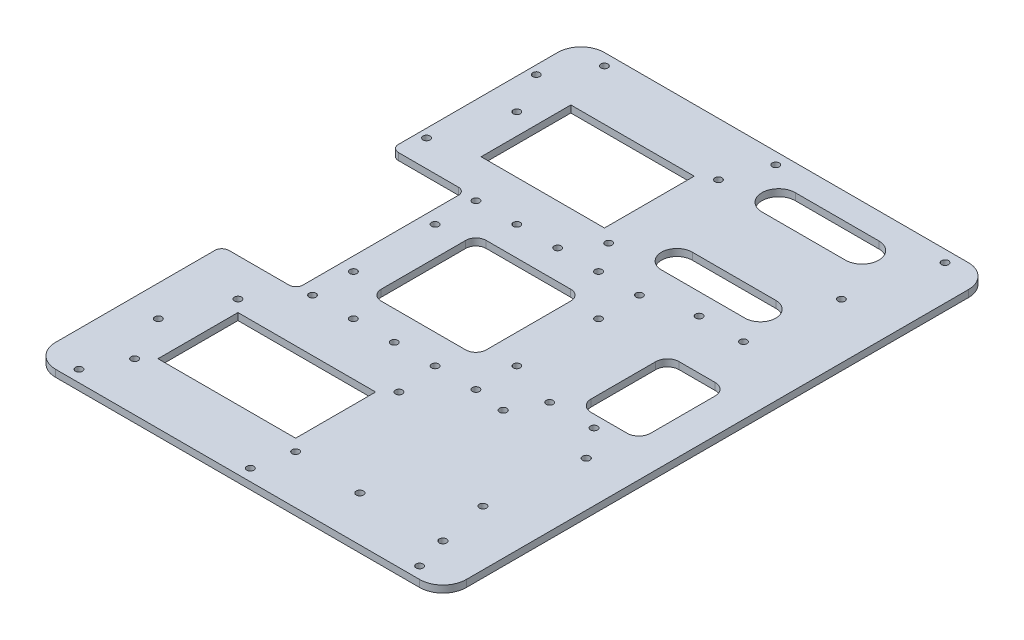
from build123d import *

# Parameters (mm, degrees)
SKETCH_2_R          = 1.5
SKETCH_2_R_2        = 1.55
SKETCH_2_W          = 58.95
SKETCH_2_H          = 34.26
SKETCH_2_W_2        = 25.458045559
SKETCH_2_H_2        = 37.682827862
SKETCH_2_W_3        = 52.836453453
SKETCH_2_H_3        = 38.433812924
EXTRUDE_2_DEPTH     = 3
FILLET_2_R          = 3
FILLET_3_R          = 5
CUT_EXTRUDE_1_DEPTH = 157.537629335
SKETCH_4_R          = 1.5
CUT_EXTRUDE_2_DEPTH = 10


with BuildPart() as part:
    # 草图2 → 凸台-拉伸2 (new body)
    with BuildSketch(Plane(origin=(0, 0, 0), x_dir=(1, 0, 0), z_dir=(0, 1, 0))):
        with BuildLine():
            Line((-72.5, -36.293945631), (-72.5, -107.5))
            ThreePointArc((-72.5, -107.5), (-69.571067812, -114.571067812), (-62.5, -117.5))
            Line((-62.5, -117.5), (93.386553273, -117.5))
            ThreePointArc((93.386553273, -117.5), (100.457621085, -114.571067812), (103.386553273, -107.5))
            Line((103.386553273, -107.5), (103.386553273, 107.5))
            ThreePointArc((103.386553273, 107.5), (100.457621085, 114.571067812), (93.386553273, 117.5))
            Line((93.386553273, 117.5), (-62.5, 117.5))
            ThreePointArc((-62.5, 117.5), (-69.571067812, 114.571067812), (-72.5, 107.5))
            Line((-72.5, 107.5), (-72.5, 36.293945631))
            Line((-72.5, 36.293945631), (-40.778460838, 36.293945631))
            Line((-40.778460838, 36.293945631), (-40.778460838, -36.293945631))
            Line((-40.778460838, -36.293945631), (-72.5, -36.293945631))
        make_face()
        with Locations((-35, 35)):
            Circle(SKETCH_2_R, mode=Mode.SUBTRACT)
        with Locations((35, 35)):
            Circle(SKETCH_2_R, mode=Mode.SUBTRACT)
        with Locations((35, -35)):
            Circle(SKETCH_2_R, mode=Mode.SUBTRACT)
        with Locations((-35, -35)):
            Circle(SKETCH_2_R, mode=Mode.SUBTRACT)
        with Locations((-17.5, 35)):
            Circle(SKETCH_2_R, mode=Mode.SUBTRACT)
        with Locations((17.5, 35)):
            Circle(SKETCH_2_R, mode=Mode.SUBTRACT)
        with Locations((-17.5, -35)):
            Circle(SKETCH_2_R, mode=Mode.SUBTRACT)
        with Locations((17.5, -35)):
            Circle(SKETCH_2_R, mode=Mode.SUBTRACT)
        with Locations((-35, 17.5)):
            Circle(SKETCH_2_R, mode=Mode.SUBTRACT)
        with Locations((-35, -17.5)):
            Circle(SKETCH_2_R, mode=Mode.SUBTRACT)
        with Locations((35, -17.5)):
            Circle(SKETCH_2_R, mode=Mode.SUBTRACT)
        with Locations((35, 17.5)):
            Circle(SKETCH_2_R, mode=Mode.SUBTRACT)
        with Locations((0, 35)):
            Circle(SKETCH_2_R, mode=Mode.SUBTRACT)
        with Locations((0, -35)):
            Circle(SKETCH_2_R, mode=Mode.SUBTRACT)
        with Locations((-49.509707517, -52.404109444)):
            Circle(SKETCH_2_R, mode=Mode.SUBTRACT)
        with Locations((-49.509707517, -96.664109444)):
            Circle(SKETCH_2_R, mode=Mode.SUBTRACT)
        with Locations((19.440292483, -52.404109444)):
            Circle(SKETCH_2_R, mode=Mode.SUBTRACT)
        with Locations((19.440292483, -96.664109444)):
            Circle(SKETCH_2_R, mode=Mode.SUBTRACT)
        with Locations((-59.25, -76.75)):
            Circle(SKETCH_2_R, mode=Mode.SUBTRACT)
        with Locations((79.75, -76.75)):
            Circle(SKETCH_2_R, mode=Mode.SUBTRACT)
        with Locations((79.75, 76.75)):
            Circle(SKETCH_2_R, mode=Mode.SUBTRACT)
        with Locations((-59.25, 76.75)):
            Circle(SKETCH_2_R, mode=Mode.SUBTRACT)
        with Locations((-68.87108956, 94.711076741)):
            Circle(SKETCH_2_R, mode=Mode.SUBTRACT)
        with Locations((-68.87108956, 47.711076741)):
            Circle(SKETCH_2_R, mode=Mode.SUBTRACT)
        with Locations((9.12891044, 47.711076741)):
            Circle(SKETCH_2_R, mode=Mode.SUBTRACT)
        with Locations((9.12891044, 94.711076741)):
            Circle(SKETCH_2_R, mode=Mode.SUBTRACT)
        with Locations((48.531405595, -36.854109444)):
            Circle(SKETCH_2_R_2, mode=Mode.SUBTRACT)
        with Locations((84.091405595, -36.854109444)):
            Circle(SKETCH_2_R_2, mode=Mode.SUBTRACT)
        with Locations((48.531405595, -98.234109444)):
            Circle(SKETCH_2_R_2, mode=Mode.SUBTRACT)
        with Locations((84.091405595, -98.234109444)):
            Circle(SKETCH_2_R_2, mode=Mode.SUBTRACT)
        with Locations((74.55341555, 40.015852562)):
            Circle(SKETCH_2_R, mode=Mode.SUBTRACT)
        with Locations((55.55341555, 40.015852562)):
            Circle(SKETCH_2_R, mode=Mode.SUBTRACT)
        with Locations((74.55341555, -23.984147438)):
            Circle(SKETCH_2_R, mode=Mode.SUBTRACT)
        with Locations((55.55341555, -23.984147438)):
            Circle(SKETCH_2_R, mode=Mode.SUBTRACT)
        with BuildLine():
            Line((-18.1, 22.5), (18.1, 22.5))
            ThreePointArc((18.1, 22.5), (21.211269837, 21.211269837), (22.5, 18.1))
            Line((22.5, 18.1), (22.5, -18.1))
            ThreePointArc((22.5, -18.1), (21.211269837, -21.211269837), (18.1, -22.5))
            Line((18.1, -22.5), (-18.1, -22.5))
            ThreePointArc((-18.1, -22.5), (-21.211269837, -21.211269837), (-22.5, -18.1))
            Line((-22.5, -18.1), (-22.5, 18.1))
            ThreePointArc((-22.5, 18.1), (-21.211269837, 21.211269837), (-18.1, 22.5))
        make_face(mode=Mode.SUBTRACT)
        with Locations((-15.034707517, -74.534109444)):
            Rectangle(SKETCH_2_W, SKETCH_2_H, mode=Mode.SUBTRACT)
        with Locations((75.885013297, 0)):
            Rectangle(SKETCH_2_W_2, SKETCH_2_H_2, mode=Mode.SUBTRACT)
        with Locations((-23.799399193, 71.645143509)):
            Rectangle(SKETCH_2_W_3, SKETCH_2_H_3, mode=Mode.SUBTRACT)
    extrude(amount=EXTRUDE_2_DEPTH)

    # 圆角2
    fillet_2_edges = [part.edges().sort_by_distance(p)[0] for p in [
        (-40.778460838, 1.5, 36.293945631),
        (-40.778460838, 1.5, -36.293945631),
        (-72.5, 1.5, 36.293945631),
        (-72.5, 1.5, -36.293945631),
    ]]
    fillet(fillet_2_edges, radius=FILLET_2_R)

    # 圆角3
    fillet_3_edges = [part.edges().sort_by_distance(p)[0] for p in [
        (88.614036076, 1.5, -18.841413931),
        (63.155990517, 1.5, -18.841413931),
        (63.155990517, 1.5, 18.841413931),
        (88.614036076, 1.5, 18.841413931),
    ]]
    fillet(fillet_3_edges, radius=FILLET_3_R)

    # 草图3 → 切除-拉伸1 (cut, through all)
    with BuildSketch(Plane(origin=(0, 3, 0), x_dir=(1, 0, 0), z_dir=(0, 1, 0))):
        with BuildLine():
            Line((30.380318315, 106.392706566), (66.1383582, 106.392706566))
            ThreePointArc((66.1383582, 106.392706566), (73.287559025, 99.243505741), (66.1383582, 92.094304917))
            Line((66.1383582, 92.094304917), (30.380318315, 92.094304917))
            ThreePointArc((30.380318315, 92.094304917), (23.23111749, 99.243505741), (30.380318315, 106.392706566))
        make_face()
        with BuildLine():
            Line((30.380318315, 62.274503657), (66.1383582, 62.274503657))
            ThreePointArc((66.1383582, 62.274503657), (72.736553362, 55.676308496), (66.1383582, 49.078113334))
            Line((66.1383582, 49.078113334), (30.380318315, 49.078113334))
            ThreePointArc((30.380318315, 49.078113334), (23.782123153, 55.676308496), (30.380318315, 62.274503657))
        make_face()
    extrude(amount=-CUT_EXTRUDE_1_DEPTH, mode=Mode.SUBTRACT)

    # 草图4 → 切除-拉伸2 (cut)
    with BuildSketch(Plane(origin=(0, 3, 0), x_dir=(1, 0, 0), z_dir=(0, 1, 0))):
        with Locations((-57.5, -112.5)):
            Circle(SKETCH_4_R)
        with Locations((15.886553273, -112.5)):
            Circle(SKETCH_4_R)
        with Locations((88.386553273, -112.5)):
            Circle(SKETCH_4_R)
        with Locations((88.386553273, 112.5)):
            Circle(SKETCH_4_R)
        with Locations((15.886553273, 112.5)):
            Circle(SKETCH_4_R)
        with Locations((-57.5, 112.5)):
            Circle(SKETCH_4_R)
    extrude(amount=-CUT_EXTRUDE_2_DEPTH, mode=Mode.SUBTRACT)


solid = part.part
